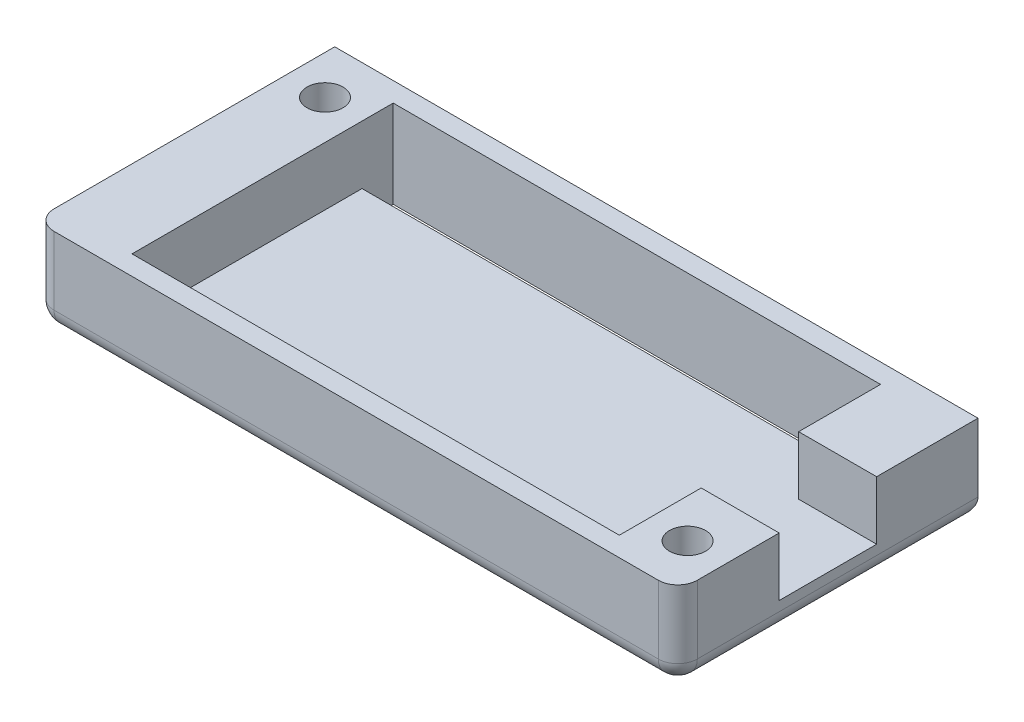
from build123d import *

# Parameters (mm, degrees)
SKETCH1_W           = 66
SKETCH1_H           = 30.8
SKETCH1_W_2         = 50
SKETCH1_H_2         = 3.2
BOSS_EXTRUDE1_DEPTH = 3
SKETCH2_W           = 66
SKETCH2_H           = 30.8
SKETCH2_W_2         = 50
SKETCH2_H_2         = 26.8
BOSS_EXTRUDE2_DEPTH = 6
SKETCH3_R           = 1.85
CUT_EXTRUDE1_DEPTH  = 74.386919815
FILLET1_R           = 2
SKETCH4_W           = 8
SKETCH4_H           = 10
CUT_EXTRUDE2_DEPTH  = 6


with BuildPart() as part:
    # Sketch1 → Boss-Extrude1 (new body)
    with BuildSketch(Plane(origin=(0, 0, 0), x_dir=(1, 0, 0), z_dir=(0, 1, 0))):
        with Locations((33, 15.4)):
            Rectangle(SKETCH1_W, SKETCH1_H)
        with Locations((33, 27.2)):
            Rectangle(SKETCH1_W_2, SKETCH1_H_2, mode=Mode.SUBTRACT)
        with Locations((33, 3.6)):
            Rectangle(SKETCH1_W_2, SKETCH1_H_2, mode=Mode.SUBTRACT)
    extrude(amount=BOSS_EXTRUDE1_DEPTH)

    # Sketch2 → Boss-Extrude2 (add)
    with BuildSketch(Plane(origin=(0, 3, 0), x_dir=(1, 0, 0), z_dir=(0, 1, 0))):
        with Locations((33, 15.4)):
            Rectangle(SKETCH2_W, SKETCH2_H)
        with Locations((33, 15.4)):
            Rectangle(SKETCH2_W_2, SKETCH2_H_2, mode=Mode.SUBTRACT)
    extrude(amount=BOSS_EXTRUDE2_DEPTH)

    # Sketch3 → Cut-Extrude1 (cut, through all)
    with BuildSketch(Plane(origin=(0, 9, 0), x_dir=(1, 0, 0), z_dir=(0, 1, 0))):
        with Locations(Location((62, 5, 0), (0, 0, 270))):
            Circle(SKETCH3_R)
        with Locations(Location((4, 25.8, 0), (0, 0, 270))):
            Circle(SKETCH3_R)
    extrude(amount=-CUT_EXTRUDE1_DEPTH, mode=Mode.SUBTRACT)

    # Fillet1
    fillet1_edges = [part.edges().sort_by_distance(p)[0] for p in [
        (33, 0, -30.8),
        (66, 0, -15.4),
        (33, 0, 0),
        (0, 0, -15.4),
        (66, 4.5, 0),
        (0, 4.5, 0),
    ]]
    fillet(fillet1_edges, radius=FILLET1_R - 0.0001)  # a hair under: the kernel refuses the full size

    # Sketch4 → Cut-Extrude2 (cut)
    with BuildSketch(Plane(origin=(0, 9, 0), x_dir=(1, 0, 0), z_dir=(0, 1, 0))):
        with Locations((62, 15.4)):
            Rectangle(SKETCH4_W, SKETCH4_H)
    extrude(amount=-CUT_EXTRUDE2_DEPTH, mode=Mode.SUBTRACT)


solid = part.part
